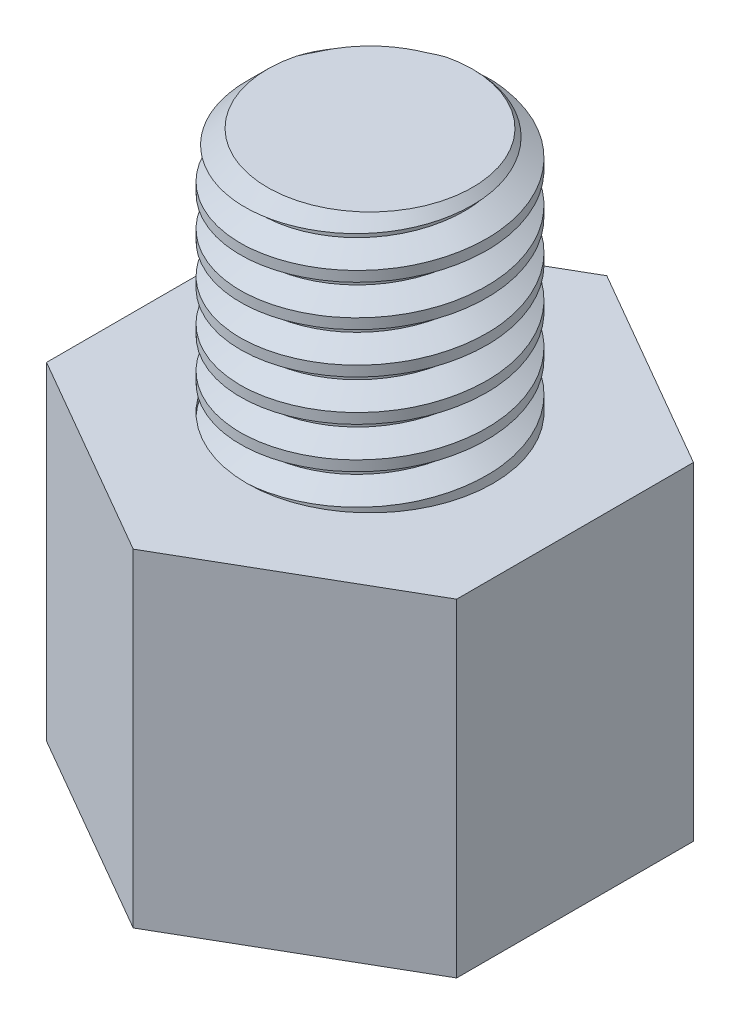
from build123d import *

# Parameters (mm, degrees)
BOSS_EXTRUDE1_DEPTH       = 4
SKETCH3_R                 = 1.5
BOSS_EXTRUDE2_DEPTH       = 3
M3X0_5_TAPPED_HOLE1_D     = 2.5
M3X0_5_TAPPED_HOLE1_DEPTH = 3.5
M3X0_5_TAPPED_HOLE1_TIP   = 0.751075774
CHAMFER1_SIZE             = 0.25
THREAD1_PITCH             = 0.5


with BuildPart() as part:
    # Sketch2 → Boss-Extrude1 (new body)
    with BuildSketch(Plane(origin=(0, 0, 0), x_dir=(1, 0, 0), z_dir=(0, 1, 0))):
        Polygon((1.25, 0.721687836), (-2.5, -1.443375673), (0, -2.886751346), (1.666666667, 0), align=None)
        Polygon((0.833333333, 1.443375673), (-2.5, 1.443375673), (-2.5, -1.443375673), (1.25, 0.721687836), align=None)
        Polygon((0.833333333, 1.443375673), (0, 2.886751346), (-2.5, 1.443375673), align=None)
        Polygon((2.5, 1.443375673), (0, 2.886751346), (0.833333333, 1.443375673), align=None)
        Polygon((1.25, 0.721687836), (2.5, 1.443375673), (0.833333333, 1.443375673), align=None)
        Polygon((1.666666667, 0), (2.5, 1.443375673), (1.25, 0.721687836), align=None)
        Polygon((2.5, -1.443375673), (2.5, 1.443375673), (1.666666667, 0), align=None)
        Polygon((0, -2.886751346), (2.5, -1.443375673), (1.666666667, 0), align=None)
    extrude(amount=BOSS_EXTRUDE1_DEPTH)

    # Sketch3 → Boss-Extrude2 (add)
    with BuildSketch(Plane(origin=(0, 4, 0), x_dir=(1, 0, 0), z_dir=(0, 1, 0))):
        with Locations(Location((0, 0, 0), (0, 0, 270))):
            Circle(SKETCH3_R)
    extrude(amount=BOSS_EXTRUDE2_DEPTH)

    # M3x0.5 Tapped Hole1
    with Locations(Plane(origin=(0, 0, 0), x_dir=(-1, 0, 0), z_dir=(0, -1, 0))):
        with Locations((0, 0)):
            Hole(M3X0_5_TAPPED_HOLE1_D / 2, depth=M3X0_5_TAPPED_HOLE1_DEPTH)
            with Locations((0, 0, -(M3X0_5_TAPPED_HOLE1_DEPTH + M3X0_5_TAPPED_HOLE1_TIP / 2))):  # 118° drill point
                Cone(0, M3X0_5_TAPPED_HOLE1_D / 2, M3X0_5_TAPPED_HOLE1_TIP, mode=Mode.SUBTRACT)

    # Chamfer1
    chamfer1_edges = [part.edges().sort_by_distance(p)[0] for p in [
        (0, 7, -1.5),
    ]]
    chamfer(chamfer1_edges, length=CHAMFER1_SIZE)

    # Thread1: the profile of Thread Profile1 profile screwed along a right-hand helix of 7 turns, 6 arcs to a turn; built about Z, then put on its axis
    thread1_z = Axis((0, 0, 0), (0, 0, 1))
    thread1_corners = [(1.5003, 0, -0.000173205), (1.229367063, 0, 0.156249999), (1.229367063, 0, 0.218749999), (1.5003, 0, 0.375173204)]
    with BuildLine(mode=Mode.PRIVATE) as thread1_profile:
        Line(thread1_corners[0], thread1_corners[1])
        Line(thread1_corners[1], thread1_corners[2])
        Line(thread1_corners[2], thread1_corners[3])
        Line(thread1_corners[3], thread1_corners[0])
    thread1_cap = Face(thread1_profile.wire())
    thread1_turn_angles = [0, 30, 60, 90, 120, 150, 180, 210, 240, 270, 300, 330, 360]
    thread1_turn_weights = [1, 0.8660254037844387, 1, 0.8660254037844387, 1, 0.8660254037844387, 1, 0.8660254037844387, 1, 0.8660254037844387, 1, 0.8660254037844387, 1]
    thread1_turn_rails = [Edge.make_bspline([Vector(p[0], p[1], 0).rotate(thread1_z, thread1_turn_angles[k]) / thread1_turn_weights[k] + Vector(0, 0, p[2] + THREAD1_PITCH * thread1_turn_angles[k] / 360) for k in range(13)], [0, 0, 0, 1, 1, 2, 2, 3, 3, 4, 4, 5, 5, 6, 6, 6], 2, thread1_turn_weights) for p in thread1_corners]
    thread1_turn_sides = [Face.make_surface_from_curves(thread1_turn_rails[p[0]], thread1_turn_rails[p[1]]) for p in [(0, 1), (1, 2), (2, 3), (3, 0)]]
    thread1 = Plane(origin=(0, 7.75, 0), x_dir=(-1, 0, 0), z_dir=(0, -1, 0)) * Solid(Shell([*[p.moved(Location((0, 0, THREAD1_PITCH * i))) for i in range(7) for p in thread1_turn_sides], thread1_cap, thread1_cap.rotate(thread1_z, 2520).moved(Location((0, 0, THREAD1_PITCH * 2520 / 360)))]))
    add(thread1, mode=Mode.SUBTRACT)


solid = part.part
